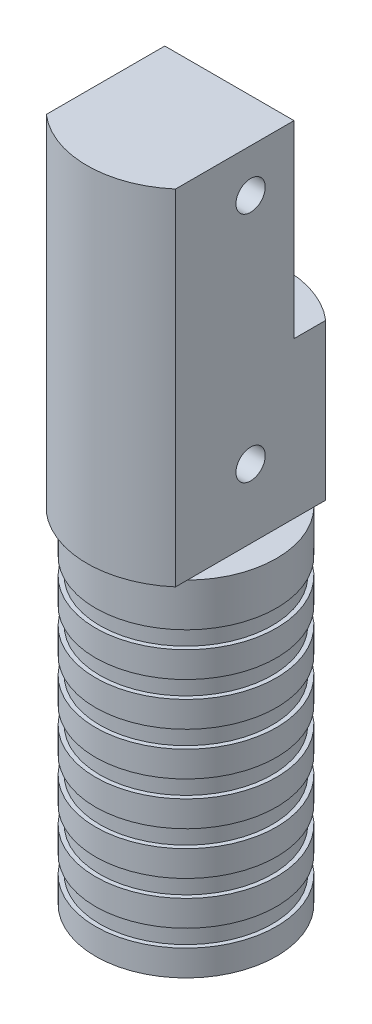
from build123d import *

# Parameters (mm, degrees)
SKETCH3_W                      = 0.5
SKETCH3_H                      = 2
LPATTERN1_COUNT                = 7
LPATTERN1_PITCH                = 5
BOSS_EXTRUDE1_DEPTH            = 40
F_15_0_15_DIAMETER_HOLE1_D     = 15
F_15_0_15_DIAMETER_HOLE1_DEPTH = 30
F_15_0_15_DIAMETER_HOLE1_TIP   = 4.506454643
M3_CLEARANCE_HOLE1_D           = 3.4
CUT_EXTRUDE1_DEPTH             = 43.924352063
CUT_EXTRUDE1_DEPTH_BACK        = 43.924352063
SKETCH16_R                     = 1.7


with BuildPart() as part:
    # Sketch2 → Revolve1 (revolve)
    with BuildSketch(Plane.XY):
        Polygon((0, 0), (-10.5, 0), (-10.5, -40), (-1, -40), (0, -40), align=None)
    revolve(axis=Axis((0, 0, 0), (0, -1, 0)))

    # Sketch3 → Cut-Revolve1 (revolve, cut)
    with BuildSketch(Plane.XY):
        with Locations((10.25, -36)):
            Rectangle(SKETCH3_W, SKETCH3_H)
    cut_revolve1 = revolve(axis=Axis((0, 0, 0), (0, -1, 0)), mode=Mode.SUBTRACT)

    # LPattern1: Cut-Revolve1 ×7
    with Locations(*[(0, i * LPATTERN1_PITCH, 0) for i in range(1, LPATTERN1_COUNT)]):
        add(cut_revolve1, mode=Mode.SUBTRACT)

    # Sketch6 → Boss-Extrude1 (add)
    with BuildSketch(Plane(origin=(0, 0, 0), x_dir=(1, 0, 0), z_dir=(0, 1, 0))):
        with BuildLine():
            Line((-7.5, 8.717797887), (-7.5, -8.717797887))
            ThreePointArc((-7.5, -8.717797887), (0, -11.5), (7.5, -8.717797887))
            Line((7.5, -8.717797887), (7.5, 8.717797887))
            ThreePointArc((7.5, 8.717797887), (0, 11.5), (-7.5, 8.717797887))
        make_face()
    extrude(amount=BOSS_EXTRUDE1_DEPTH)

    # Ø15.0 (15) Diameter Hole1
    with Locations(Plane.XZ.offset(40)):
        with Locations((0, 0)):
            Hole(F_15_0_15_DIAMETER_HOLE1_D / 2, depth=F_15_0_15_DIAMETER_HOLE1_DEPTH)
            with Locations((0, 0, -(F_15_0_15_DIAMETER_HOLE1_DEPTH + F_15_0_15_DIAMETER_HOLE1_TIP / 2))):  # 118° drill point
                Cone(0, F_15_0_15_DIAMETER_HOLE1_D / 2, F_15_0_15_DIAMETER_HOLE1_TIP, mode=Mode.SUBTRACT)

    # M3 Clearance Hole1 (through all)
    with Locations(Plane(origin=(7.5, 0, 0), x_dir=(0, 0, -1), z_dir=(1, 0, 0))):
        with Locations((0, 8), (0, 35)):
            Hole(M3_CLEARANCE_HOLE1_D / 2)

    # Sketch16 → Cut-Extrude1 (cut, two sides: drawn at the far end of the back side and taken through both)
    with BuildSketch(Plane(origin=(0, 0, 0), x_dir=(0, 0, -1), z_dir=(1, 0, 0)).offset(-CUT_EXTRUDE1_DEPTH_BACK)):
        with Locations((0, 8)):
            Circle(SKETCH16_R)
        with Locations((0, 35)):
            Circle(SKETCH16_R)
        Polygon((5.037728025, 40), (5.037728025, 18.081644681), (11.5, 18.081644681), (11.5, 40), (8.717797887, 40), align=None)
    extrude(amount=CUT_EXTRUDE1_DEPTH + CUT_EXTRUDE1_DEPTH_BACK, mode=Mode.SUBTRACT)


solid = part.part
